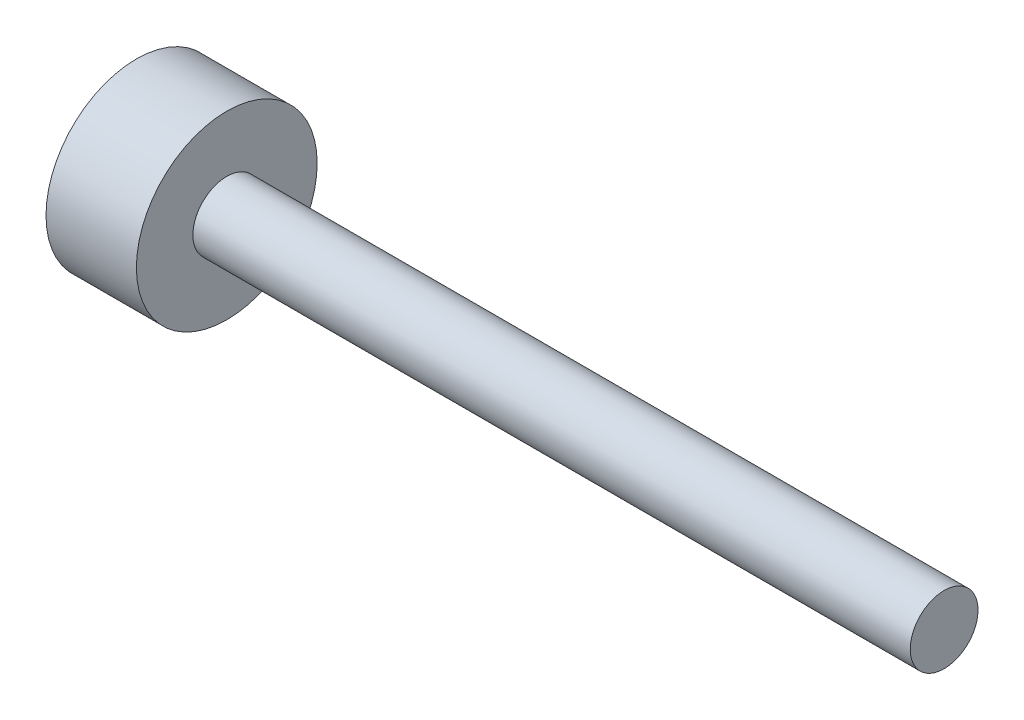
from build123d import *


with BuildPart() as part:
    # Sketch1 → Revolve1 (revolve)
    with BuildSketch(Plane.XY):
        Polygon((0, 0), (0, 0.75), (-15.872000006, 0.75), (-15.872000006, 2), (-17.872000006, 2), (-17.872000006, 0), align=None)
    revolve(axis=Axis((0, 0, 0), (-1, 0, 0)))


solid = part.part
